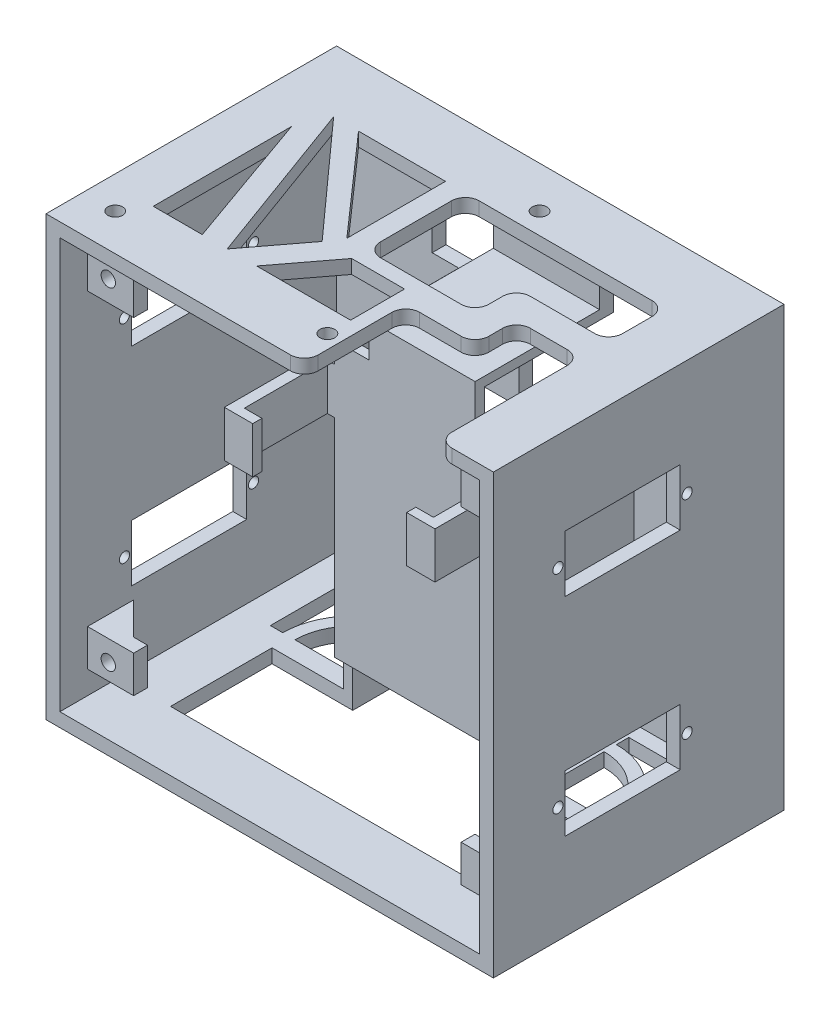
from build123d import *

# Parameters (mm, degrees)
SKETCH_1_W          = 97
SKETCH_1_H          = 95
EXTRUDE_1_DEPTH     = 3
SKETCH_2_W          = 97
SKETCH_2_H          = 95
SKETCH_2_W_2        = 91
SKETCH_2_H_2        = 89
EXTRUDE_2_DEPTH     = 60
SKETCH_3_W          = 34
SKETCH_3_H          = 75
CUT_EXTRUDE_1_DEPTH = 30
EXTRUDE_3_DEPTH     = 27
SKETCH_5_W          = 37
SKETCH_5_H          = 77
EXTRUDE_4_DEPTH     = 2
SKETCH_6_W          = 11
SKETCH_6_H          = 15
EXTRUDE_5_DEPTH     = 3
EXTRUDE_5_2_DEPTH   = 3
EXTRUDE_5_3_DEPTH   = 3
EXTRUDE_5_4_DEPTH   = 3
SKETCH_9_W          = 13.258922795
SKETCH_9_H          = 12.943234157
CUT_EXTRUDE_3_DEPTH = 30
SKETCH_10_W         = 69
SKETCH_10_H         = 22
CUT_EXTRUDE_4_DEPTH = 10
SKETCH_12_R         = 1.6
CUT_EXTRUDE_5_DEPTH = 5
FILLET_1_R          = 3
EXTRUDE_6_DEPTH     = 10
SKETCH_15_W         = 10
SKETCH_15_H         = 8
SKETCH_15_R         = 1.55
EXTRUDE_8_DEPTH     = 3
CHAMFER_1_SIZE      = 7
SKETCH_16_R         = 1.1
SKETCH_16_W         = 25
SKETCH_16_H         = 12.3
CUT_EXTRUDE_6_DEPTH = 20
SKETCH_17_R         = 1.1
SKETCH_17_W         = 25
SKETCH_17_H         = 12.3
CUT_EXTRUDE_7_DEPTH = 3
SKETCH_18_W         = 15
SKETCH_18_H         = 15
EXTRUDE_9_DEPTH     = 4
SKETCH_19_W         = 7
SKETCH_19_H         = 3
CUT_EXTRUDE_8_DEPTH = 9
FILLET_2_R          = 10


with BuildPart() as part:
    # 草图1 → 凸台-拉伸1 (new body)
    with BuildSketch(Plane.XY):
        with Locations((48.5, 47.5)):
            Rectangle(SKETCH_1_W, SKETCH_1_H)
    extrude(amount=EXTRUDE_1_DEPTH)

    # 草图2 → 凸台-拉伸2 (add)
    with BuildSketch(Plane.XY.offset(3)):
        with Locations((48.5, 47.5)):
            Rectangle(SKETCH_2_W, SKETCH_2_H)
        with Locations((48.5, 47.5)):
            Rectangle(SKETCH_2_W_2, SKETCH_2_H_2, mode=Mode.SUBTRACT)
    extrude(amount=EXTRUDE_2_DEPTH)

    # 草图3 → 切除-拉伸1 (cut)
    with BuildSketch(Plane(origin=(0, 0, 0), x_dir=(-1, 0, 0), z_dir=(0, 0, -1))):
        with Locations((-48.5, 37.5)):
            Rectangle(SKETCH_3_W, SKETCH_3_H)
    extrude(amount=-CUT_EXTRUDE_1_DEPTH, mode=Mode.SUBTRACT)

    # 草图4 → 凸台-拉伸3 (add)
    with BuildSketch(Plane.XY.offset(3)):
        Polygon((29.5, 77), (67.5, 77), (67.5, 0), (65.5, 0), (65.5, 75), (31.5, 75), (31.5, 0), (29.5, 0), align=None)
    extrude(amount=EXTRUDE_3_DEPTH)

    # 草图5 → 凸台-拉伸4 (add)
    with BuildSketch(Plane.XY.offset(30)):
        with Locations((48, 38.5)):
            Rectangle(SKETCH_5_W, SKETCH_5_H)
    extrude(amount=-EXTRUDE_4_DEPTH)

    # 草图9 → 切除-拉伸3 (cut)
    with BuildSketch(Plane(origin=(0, 0, 0), x_dir=(-1, 0, 0), z_dir=(0, 0, -1))):
        with Locations((-30.347584004, 76.017206964)):
            Rectangle(SKETCH_9_W, SKETCH_9_H)
        with Locations((-66.652415996, 76.017206964)):
            Rectangle(SKETCH_9_W, SKETCH_9_H)
    extrude(amount=-CUT_EXTRUDE_3_DEPTH, mode=Mode.SUBTRACT)

    # 草图10 → 切除-拉伸4 (cut)
    with BuildSketch(Plane.XZ):
        with Locations((48.5, 39)):
            Rectangle(SKETCH_10_W, SKETCH_10_H)
        with BuildLine():
            Line((27.5, 24), (15, 24))
            ThreePointArc((15, 24), (18.661165235, 15.161165235), (27.5, 11.5))
            Line((27.5, 11.5), (27.5, 24))
        make_face()
        with BuildLine():
            Line((12.336338906, 24), (9.644015318, 24))
            Line((9.644015318, 24), (9.644015318, 8.726147827))
            Line((9.644015318, 8.726147827), (15.564618041, 14.646750551))
            ThreePointArc((15.564618041, 14.646750551), (13.166111749, 19.052650673), (12.336338906, 24))
        make_face()
        with BuildLine():
            Line((12.226147827, 6.144015318), (18.146750551, 12.064618041))
            ThreePointArc((18.146750551, 12.064618041), (22.552650673, 9.666111749), (27.5, 8.836338906))
            Line((27.5, 8.836338906), (27.5, 6.144015318))
            Line((27.5, 6.144015318), (12.226147827, 6.144015318))
        make_face()
        with BuildLine():
            Line((87.355984682, 8.726147827), (81.435381959, 14.646750551))
            ThreePointArc((81.435381959, 14.646750551), (83.833888251, 19.052650673), (84.663661094, 24))
            Line((84.663661094, 24), (87.355984682, 24))
            Line((87.355984682, 24), (87.355984682, 8.726147827))
        make_face()
        with BuildLine():
            Line((69.5, 8.836338906), (69.5, 6.144015318))
            Line((69.5, 6.144015318), (84.773852173, 6.144015318))
            Line((84.773852173, 6.144015318), (78.853249449, 12.064618041))
            ThreePointArc((78.853249449, 12.064618041), (74.447349327, 9.666111749), (69.5, 8.836338906))
        make_face()
        with BuildLine():
            Line((69.5, 24), (82, 24))
            ThreePointArc((82, 24), (78.338834765, 15.161165235), (69.5, 11.5))
            Line((69.5, 11.5), (69.5, 24))
        make_face()
    extrude(amount=-CUT_EXTRUDE_4_DEPTH, mode=Mode.SUBTRACT)

    # 草图12 → 切除-拉伸5 (cut)
    with BuildSketch(Plane(origin=(0, 95, 0), x_dir=(1, 0, 0), z_dir=(0, 1, 0))):
        with Locations(Location((7, -55, 0), (0, 0, 270))):
            Circle(SKETCH_12_R)
        with Locations(Location((53, -9, 0), (0, 0, 270))):
            Circle(SKETCH_12_R)
        with Locations(Location((53, -55, 0), (0, 0, 270))):
            Circle(SKETCH_12_R)
        Polygon((85, -63), (56, -63), (56, -41), (71, -41), (71, -32), (85, -32), (85, -41), align=None)
        Polygon((41.525848903, -35), (65, -35), (65, -26), (85, -26), (85, -13.607981412), (41.525848903, -13.607981412), align=None)
        Polygon((53, -38.266587076), (41.525848903, -38.266587076), (32.642108816, -49.973197846), (53, -49.973197846), align=None)
        Polygon((37.221280887, -35), (37.221280887, -13.607981412), (18.361704189, -13.607981412), align=None)
        Polygon((35.132877064, -38.266587076), (26.249136977, -49.973197846), (12.96503965, -13.607981412), align=None)
        Polygon((20.852472438, -49.973197846), (10.225194576, -20.000953251), (10.225194576, -49.973197846), align=None)
    extrude(amount=-CUT_EXTRUDE_5_DEPTH, mode=Mode.SUBTRACT)

    # 圆角1
    fillet_1_edges = [part.edges().sort_by_distance(p)[0] for p in [
        (41.525848903, 93.5, 35),
        (41.525848903, 93.5, 13.607981412),
        (85, 93.5, 13.607981412),
        (85, 93.5, 26),
        (65, 93.5, 26),
        (65, 93.5, 35),
        (85, 93.5, 63),
        (56, 93.5, 63),
        (56, 93.5, 41),
        (71, 93.5, 41),
        (71, 93.5, 32),
        (85, 93.5, 32),
    ]]
    fillet(fillet_1_edges, radius=FILLET_1_R)

    # 草图13 → 凸台-拉伸6 (add)
    with BuildSketch(Plane(origin=(0, 65, 0), x_dir=(1, 0, 0), z_dir=(0, 1, 0))):
        Polygon((29.5, -30), (28, -30), (28, -48), (31.811852733, -48), (31.811852733, -50), (25.667957719, -50), (25.667957719, -41.033234304), (25.667957719, -28), (27.640354371, -28), (29.5, -28), align=None)
        Polygon((67.5, -30), (69, -30), (69, -48), (65.188147267, -48), (65.188147267, -50), (71.332042281, -50), (71.332042281, -41.033234304), (71.332042281, -28), (69.359645629, -28), (67.5, -28), align=None)
    extrude(amount=-EXTRUDE_6_DEPTH)

    # 草图15 → 凸台-拉伸8 (add)
    # profile 1 of 4: a face of its own
    with BuildSketch(Plane.XY.offset(54)):
        with Locations((8, 83)):
            Rectangle(SKETCH_15_W, SKETCH_15_H)
        with Locations((7.5, 83.5)):
            Circle(SKETCH_15_R, mode=Mode.SUBTRACT)
    # profile 2 of 4: a face of its own
    with BuildSketch(Plane.XY.offset(54)):
        with Locations((89, 83)):
            Rectangle(SKETCH_15_W, SKETCH_15_H)
        with Locations((89.5, 83.5)):
            Circle(SKETCH_15_R, mode=Mode.SUBTRACT)
    # profile 3 of 4: a face of its own
    with BuildSketch(Plane.XY.offset(54)):
        with Locations((89, 12)):
            Rectangle(SKETCH_15_W, SKETCH_15_H)
        with Locations((89.5, 11.5)):
            Circle(SKETCH_15_R, mode=Mode.SUBTRACT)
    # profile 4 of 4: a face of its own
    with BuildSketch(Plane.XY.offset(54)):
        with Locations((8, 12)):
            Rectangle(SKETCH_15_W, SKETCH_15_H)
        with Locations((7.5, 11.5)):
            Circle(SKETCH_15_R, mode=Mode.SUBTRACT)
    extrude(amount=EXTRUDE_8_DEPTH)

    # 倒角1
    # the kernel refuses this chamfer: 7 mm, written as the material it adds along each edge
    with BuildSketch(Plane(origin=(94, 87, 54), x_dir=(0.0274958766105881, 0, -0.9996219169112968), z_dir=(0, -1, 0))) as chamfer_1_piece_1_section:
        Polygon((CHAMFER_1_SIZE * 0.999621916911, -CHAMFER_1_SIZE * 0.0274958766106), (-CHAMFER_1_SIZE * 0.0274958766106, -CHAMFER_1_SIZE * 0.999621916911), (0, 0), align=None)
    chamfer_1_piece_1 = extrude(amount=8, mode=Mode.PRIVATE)
    chamfer_1_piece_1 = chamfer_1_piece_1 - Plane(origin=(89.5, 83.5, 51.584604316), x_dir=(1, 0, 0), z_dir=(0, 0, -1)) * Cylinder(1.55, 44, mode=Mode.PRIVATE)
    add(chamfer_1_piece_1)
    with BuildSketch(Plane(origin=(94, 8, 54), x_dir=(0.02749587661059007, 0, -0.9996219169112966), z_dir=(0, 1, 0))) as chamfer_1_piece_2_section:
        Polygon((CHAMFER_1_SIZE * 0.999621916911, CHAMFER_1_SIZE * 0.0274958766106), (-CHAMFER_1_SIZE * 0.0274958766106, CHAMFER_1_SIZE * 0.999621916911), (0, 0), align=None)
    chamfer_1_piece_2 = extrude(amount=8, mode=Mode.PRIVATE)
    chamfer_1_piece_2 = chamfer_1_piece_2 - Plane(origin=(89.5, 11.5, 51.58460444), x_dir=(1, 0, 0), z_dir=(0, 0, -1)) * Cylinder(1.55, 44, mode=Mode.PRIVATE)
    add(chamfer_1_piece_2)
    with BuildSketch(Plane(origin=(3, 8, 54), x_dir=(-0.027495876610584953, 0, -0.9996219169112968), z_dir=(0, 1, 0))) as chamfer_1_piece_3_section:
        Polygon((CHAMFER_1_SIZE * 0.999621916911, -CHAMFER_1_SIZE * 0.0274958766106), (-CHAMFER_1_SIZE * 0.0274958766106, -CHAMFER_1_SIZE * 0.999621916911), (0, 0), align=None)
    chamfer_1_piece_3 = extrude(amount=8, mode=Mode.PRIVATE)
    chamfer_1_piece_3 = chamfer_1_piece_3 - Plane(origin=(7.5, 11.5, 51.584609812), x_dir=(1, 0, 0), z_dir=(0, 0, -1)) * Cylinder(1.55, 44, mode=Mode.PRIVATE)
    add(chamfer_1_piece_3)
    with BuildSketch(Plane(origin=(3, 79, 54), x_dir=(-0.027495876610586372, 0, -0.9996219169112968), z_dir=(0, 1, 0))) as chamfer_1_piece_4_section:
        Polygon((CHAMFER_1_SIZE * 0.999621916911, -CHAMFER_1_SIZE * 0.0274958766106), (-CHAMFER_1_SIZE * 0.0274958766106, -CHAMFER_1_SIZE * 0.999621916911), (0, 0), align=None)
    chamfer_1_piece_4 = extrude(amount=8, mode=Mode.PRIVATE)
    chamfer_1_piece_4 = chamfer_1_piece_4 - Plane(origin=(7.5, 83.5, 51.584609884), x_dir=(1, 0, 0), z_dir=(0, 0, -1)) * Cylinder(1.55, 44, mode=Mode.PRIVATE)
    add(chamfer_1_piece_4)
    with BuildSketch(Plane(origin=(67.5, 65, 28), x_dir=(-0.027495876610586112, 0, -0.9996219169112968), z_dir=(0, -1, 0))) as chamfer_1_piece_5_section:
        Polygon((CHAMFER_1_SIZE * 0.999621916911, CHAMFER_1_SIZE * 0.0274958766106), (-CHAMFER_1_SIZE * 0.0274958766106, CHAMFER_1_SIZE * 0.999621916911), (0, 0), align=None)
    chamfer_1_piece_5 = extrude(amount=10, mode=Mode.PRIVATE)
    chamfer_1_piece_5 = split(chamfer_1_piece_5, bisect_by=Plane(origin=(71.332042281, 60, 25.309165807), z_dir=(-1, 0, 0)), keep=Keep.TOP, mode=Mode.PRIVATE)
    add(chamfer_1_piece_5)
    with BuildSketch(Plane(origin=(29.5, 65, 28), x_dir=(0.027495876610586605, 0, -0.9996219169112968), z_dir=(0, -1, 0))) as chamfer_1_piece_6_section:
        Polygon((CHAMFER_1_SIZE * 0.999621916911, -CHAMFER_1_SIZE * 0.0274958766106), (-CHAMFER_1_SIZE * 0.0274958766106, -CHAMFER_1_SIZE * 0.999621916911), (0, 0), align=None)
    chamfer_1_piece_6 = extrude(amount=10, mode=Mode.PRIVATE)
    chamfer_1_piece_6 = split(chamfer_1_piece_6, bisect_by=Plane(origin=(25.667957719, 60, 25.309165807), z_dir=(1, 0, 0)), keep=Keep.TOP, mode=Mode.PRIVATE)
    add(chamfer_1_piece_6)

    # 草图16 → 切除-拉伸6 (cut)
    with BuildSketch(Plane.ZY):
        with Locations((49, 25)):
            Circle(SKETCH_16_R)
        with Locations((21, 25)):
            Circle(SKETCH_16_R)
        with Locations((21, 70)):
            Circle(SKETCH_16_R)
        with Locations((49, 70)):
            Circle(SKETCH_16_R)
        with Locations((35, 70)):
            Rectangle(SKETCH_16_W, SKETCH_16_H)
        with Locations((35, 25)):
            Rectangle(SKETCH_16_W, SKETCH_16_H)
    extrude(amount=-CUT_EXTRUDE_6_DEPTH, mode=Mode.SUBTRACT)

    # 草图17 → 切除-拉伸7 (cut)
    with BuildSketch(Plane.ZY.offset(-94)):
        with Locations((49, 25)):
            Circle(SKETCH_17_R)
        with Locations((21, 25)):
            Circle(SKETCH_17_R)
        with Locations((49, 70)):
            Circle(SKETCH_17_R)
        with Locations((21, 70)):
            Circle(SKETCH_17_R)
        with Locations((35, 25)):
            Rectangle(SKETCH_17_W, SKETCH_17_H)
        with Locations((35, 70)):
            Rectangle(SKETCH_17_W, SKETCH_17_H)
    extrude(amount=-CUT_EXTRUDE_7_DEPTH, mode=Mode.SUBTRACT)



with BuildPart() as body_2:
    # 草图6 → 凸台-拉伸5 (new body)
    with BuildSketch(Plane(origin=(0, 0, 0), x_dir=(-1, 0, 0), z_dir=(0, 0, -1))):
        with Locations((-60, 57.5)):
            Rectangle(SKETCH_6_W, SKETCH_6_H)
    extrude(amount=-EXTRUDE_5_DEPTH)


with BuildPart() as body_3:
    # 草图6 → Extrude 5 2 (new body)
    with BuildSketch(Plane(origin=(0, 0, 0), x_dir=(-1, 0, 0), z_dir=(0, 0, -1))):
        with Locations((-37, 57.5)):
            Rectangle(SKETCH_6_W, SKETCH_6_H)
    extrude(amount=-EXTRUDE_5_2_DEPTH)


with BuildPart() as body_4:
    # 草图6 → Extrude 5 3 (new body)
    with BuildSketch(Plane(origin=(0, 0, 0), x_dir=(-1, 0, 0), z_dir=(0, 0, -1))):
        with Locations((-60, 30.5)):
            Rectangle(SKETCH_6_W, SKETCH_6_H)
    extrude(amount=-EXTRUDE_5_3_DEPTH)


with BuildPart() as body_5:
    # 草图6 → Extrude 5 4 (new body)
    with BuildSketch(Plane(origin=(0, 0, 0), x_dir=(-1, 0, 0), z_dir=(0, 0, -1))):
        with Locations((-37, 30.5)):
            Rectangle(SKETCH_6_W, SKETCH_6_H)
    extrude(amount=-EXTRUDE_5_4_DEPTH)


with BuildPart() as part_1:
    add(part.part)

    add(body_4.part)  # 凸台-拉伸9 merges body 4

    add(body_5.part)  # 凸台-拉伸9 merges body 5
    # 草图18 → 凸台-拉伸9 (add)
    with BuildSketch(Plane(origin=(0, 0, 0), x_dir=(-1, 0, 0), z_dir=(0, 0, -1))):
        with Locations((-62, 30.5)):
            Rectangle(SKETCH_18_W, SKETCH_18_H)
        with Locations((-35, 30.5)):
            Rectangle(SKETCH_18_W, SKETCH_18_H)
    extrude(amount=EXTRUDE_9_DEPTH)

    # 草图19 → 切除-拉伸8 (cut)
    with BuildSketch(Plane.XZ.offset(-23)):
        with Locations((35, -0.42519274)):
            Rectangle(SKETCH_19_W, SKETCH_19_H)
        with Locations((62, -0.42519274)):
            Rectangle(SKETCH_19_W, SKETCH_19_H)
    extrude(amount=-CUT_EXTRUDE_8_DEPTH, mode=Mode.SUBTRACT)

    # 圆角2
    # the kernel refuses this fillet: 10 mm, written as the material it adds along each edge
    with BuildSketch(Plane(origin=(69.5, 23, 0), x_dir=(1, 0, 0), z_dir=(0, 1, 0)), Plane(origin=(27.5, 38, 0), x_dir=(-1, 0, 0), z_dir=(0, -1, 0))) as fillet_2_piece_1:
        with BuildLine():
            CenterArc((8, 10), FILLET_2_R, 216.869897646, 53.130102354)
            Line((0, 4), (-0.16, 3.88))
            ThreePointArc((-0.16, 3.88), (-0.2, 2), (-0.2, 0))
            Line((-0.2, 0), (0, -0.2))
            Line((0, -0.2), (8, -0.2))
            Line((8, -0.2), (8, 0))
        make_face()
    extrude(amount=15)


solid = Compound([body_2.part, body_3.part, part_1.part])
